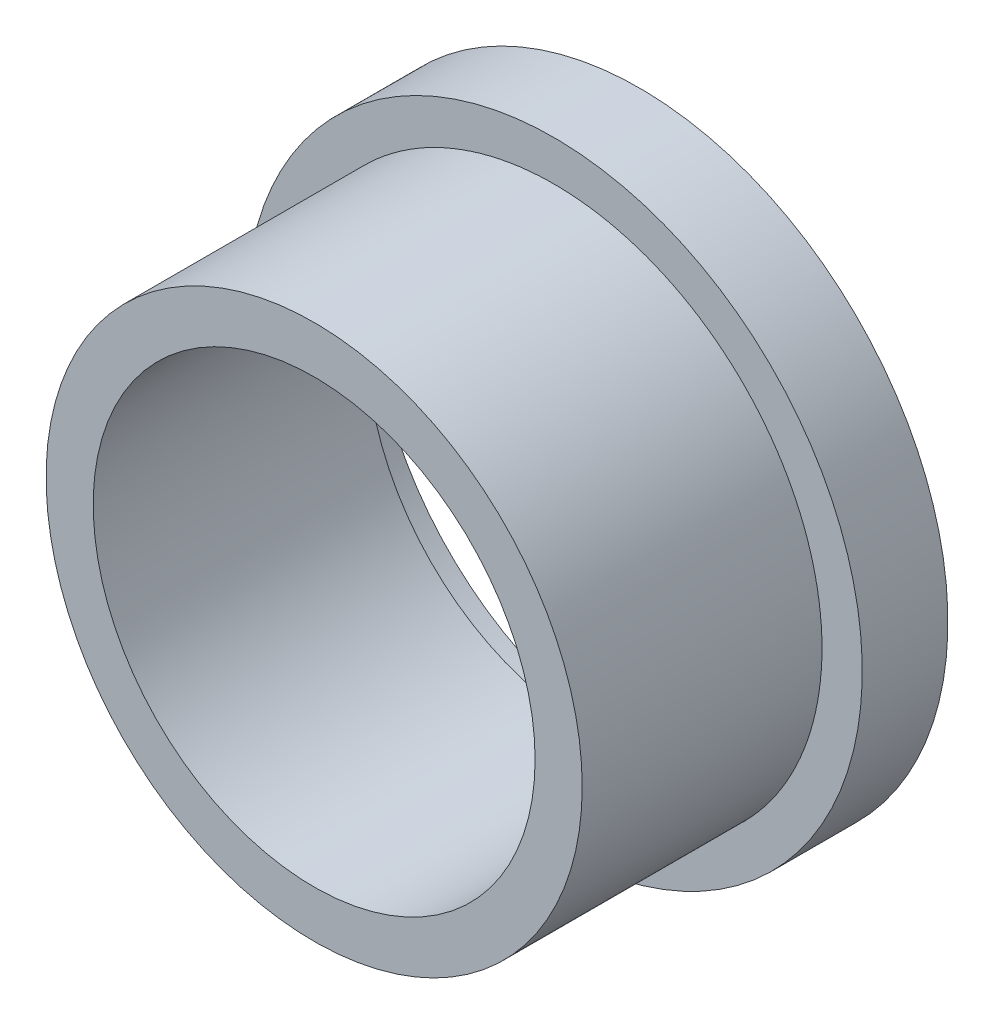
from build123d import *

# Parameters (mm, degrees)
SKETCH1_R                = 7.825
SKETCH1_R_2              = 6.45
BOSS_EXTRUDE1_DEPTH      = 8
BOSS_EXTRUDE2_DEPTH      = 1.5
BOSS_EXTRUDE2_DEPTH_BACK = 1
SKETCH2_R                = 9
SKETCH2_R_2              = 7.825


with BuildPart() as part:
    # Sketch1 → Boss-Extrude1 (new body)
    with BuildSketch(Plane.XY):
        Circle(SKETCH1_R)
        Circle(SKETCH1_R_2, mode=Mode.SUBTRACT)
    extrude(amount=BOSS_EXTRUDE1_DEPTH)


with BuildPart() as body_2:
    # Sketch2 → Boss-Extrude2 (new, two sides: drawn at the far end of the back side and taken through both)
    with BuildSketch(Plane(origin=(0, 0, 0), x_dir=(-1, 0, 0), z_dir=(0, 0, -1)).offset(-BOSS_EXTRUDE2_DEPTH_BACK)):
        Circle(SKETCH2_R)
        Circle(SKETCH2_R_2, mode=Mode.SUBTRACT)
    extrude(amount=BOSS_EXTRUDE2_DEPTH + BOSS_EXTRUDE2_DEPTH_BACK)


solid = Compound([part.part, body_2.part])
